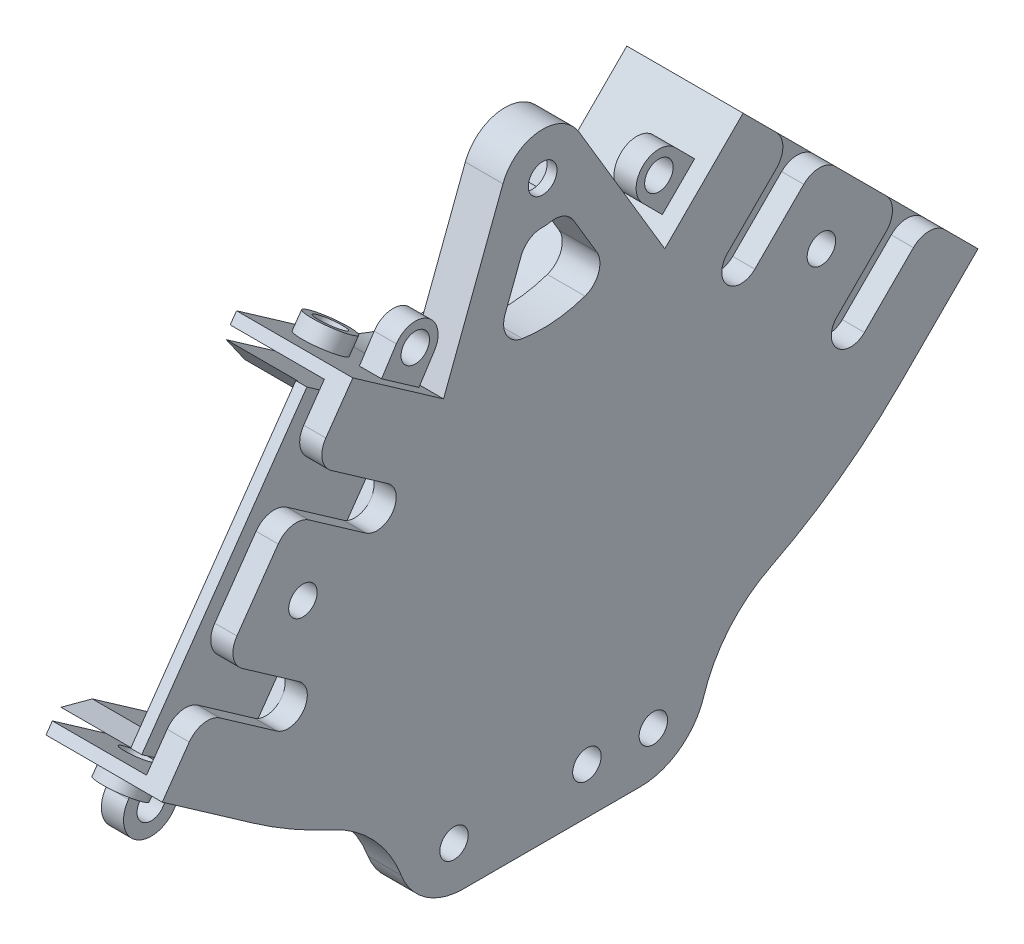
from build123d import *
from build123d.topology import SkipClean

# Parameters (mm, degrees)
BASE_EXTRUDE_DEPTH              = 58.42
BASE_EXTRUDE_2_DEPTH            = 58.42
OUTER_WALL_DEPTH                = 7.62
SKETCH6_W                       = 73.66
SKETCH6_H                       = 76.2
SKETCH6_W_2                     = 68.58
SKETCH6_H_2                     = 71.12
SKETCH6_W_3                     = 63.5
SKETCH6_H_3                     = 66.04
SKETCH6_W_4                     = 58.42
SKETCH6_H_4                     = 60.96
ENDCAP_1_DEPTH                  = 25.4
SKETCH7_W                       = 73.66
SKETCH7_H                       = 76.2
SKETCH7_W_2                     = 68.58
SKETCH7_H_2                     = 71.12
SKETCH7_W_3                     = 63.5
SKETCH7_H_3                     = 66.04
SKETCH7_W_4                     = 58.42
SKETCH7_H_4                     = 60.96
ENDCAP_2_DEPTH                  = 25.4
INTERNAL_CHAMFER_SIZE           = 2.773453185
INTERNAL_CHAMFER_SIZE_2         = 7.62
FLYWHEEL_HOLE_REACH             = 158.41
SKETCH10_W                      = 25.4
SKETCH10_H                      = 177.72143494
SKETCH11_R                      = 4.064
SKETCH11_R_2                    = 2.5
FLYWHEEL_HOLDER_DEPTH           = 7.62
SKETCH12_R                      = 14.605
MOTOR_INSERT_DEPTH              = 6.35
SKETCH14_W                      = 212.132210094
SKETCH14_H                      = 160.972819264
CUT_EXTRUDE2_DEPTH              = 49.53
SKETCH15_R                      = 3.2639
JOINING_SCREW_HOLES_DEPTH       = 5.08
SKETCH16_R                      = 3.2639
FLYWHEEL_COVER_CONNECTORS_DEPTH = 5.08
F_80_20_START                   = -5.08
SKETCH17_R                      = 3.2639
F_80_20_CONNECTOR_DEPTH         = 5.08
FILLET1_R                       = 30.48
FILLET2_R                       = 15.24
SUPPORT_REMOVAL_REACH           = 169.33
FILLET3_R                       = 5.08
CUT_EXTRUDE3_REACH              = 169.33
SKETCH19_R                      = 3.2639
CUT_EXTRUDE4_REACH              = 200.014
SKETCH20_R                      = 3.2639
CUT_EXTRUDE5_REACH              = 197.272
SKETCH21_R                      = 3.2639
SKETCH22_R                      = 3.2639
THICKEN_2_DEPTH                 = 2.54
AXLE_START                      = -8.636
SKETCH23_R                      = 3.302
AXLE_HOLDER_DEPTH               = 8.636
FILLET4_R                       = 5.08
NUT_HOLE_DEPTH                  = 6.35
SKETCH25_R                      = 5.08
SKETCH25_R_2                    = 3.2639
BOSS_EXTRUDE1_DEPTH             = 3.81
BOSS_EXTRUDE2_START             = 3.81
SKETCH26_R                      = 5.08
SKETCH26_R_2                    = 3.2639
BOSS_EXTRUDE2_DEPTH             = 3.81


with BuildPart() as part:
    # Sketch3 → Base extrude (new body)
    with BuildSketch(Plane(origin=(0, 0, 0), x_dir=(0, 0, -1), z_dir=(1, 0, 0))):
        with BuildLine():
            Line((-62.063264719, -88.6355278), (-66.433917164, -94.877466378))
            ThreePointArc((-66.433917164, -94.877466378), (10.094726748, -115.383254712), (81.899935824, -81.899935824))
            Line((81.899935824, -81.899935824), (76.511782152, -76.511782152))
            ThreePointArc((76.511782152, -76.511782152), (9.430599988, -107.792251112), (-62.063264719, -88.6355278))
        make_face()
    extrude(amount=BASE_EXTRUDE_DEPTH)



with BuildPart() as body_2:
    # Sketch3 → Base extrude 2 (new body)
    with BuildSketch(Plane(origin=(0, 0, 0), x_dir=(0, 0, -1), z_dir=(1, 0, 0))):
        with BuildLine():
            ThreePointArc((28.018399098, -28.018399098), (3.453459151, -39.473218717), (-22.727392714, -32.458080603))
            Line((-22.727392714, -32.458080603), (-27.098045159, -38.70001918))
            ThreePointArc((-27.098045159, -38.70001918), (4.11758591, -47.064222317), (33.40655277, -33.40655277))
            Line((33.40655277, -33.40655277), (28.018399098, -28.018399098))
        make_face()
    extrude(amount=BASE_EXTRUDE_2_DEPTH)


with BuildPart() as part_1:
    add(part.part)

    add(body_2.part)  # Outer wall merges body 2
    # Sketch4 → Outer wall (add)
    with BuildSketch(Plane(origin=(58.42, 0, 0), x_dir=(0, 0, -1), z_dir=(1, 0, 0))):
        with BuildLine():
            Line((-66.433917164, -94.877466378), (-22.727392714, -32.458080603))
            ThreePointArc((-22.727392714, -32.458080603), (3.453459151, -39.473218717), (28.018399098, -28.018399098))
            Line((28.018399098, -28.018399098), (81.899935824, -81.899935824))
            ThreePointArc((81.899935824, -81.899935824), (10.094726748, -115.383254712), (-66.433917164, -94.877466378))
        make_face()
    outer_wall = extrude(amount=OUTER_WALL_DEPTH)

    # Mirror1: Outer wall across plane
    add(outer_wall.mirror(Plane.ZY.offset(-29.21)))

    # Sketch6 → Endcap 1 (add)
    # profile 1 of 2: a face of its own
    with BuildSketch(Plane(origin=(0, 0, 0), x_dir=(1, 0, 0), z_dir=(0, 0.5735764363510462, 0.8191520442889917))):
        with Locations((29.21, -77.724)):
            Rectangle(SKETCH6_W, SKETCH6_H)
        with Locations((29.21, -77.724)):
            Rectangle(SKETCH6_W_2, SKETCH6_H_2, mode=Mode.SUBTRACT)
    # profile 2 of 2: a face of its own
    with BuildSketch(Plane(origin=(0, 0, 0), x_dir=(1, 0, 0), z_dir=(0, 0.5735764363510462, 0.8191520442889917))):
        with Locations((29.21, -77.724)):
            Rectangle(SKETCH6_W_3, SKETCH6_H_3)
        with Locations((29.21, -77.724)):
            Rectangle(SKETCH6_W_4, SKETCH6_H_4, mode=Mode.SUBTRACT)
    extrude(amount=ENDCAP_1_DEPTH)

    # Sketch7 → Endcap 2 (add)
    # profile 1 of 2: a face of its own
    with BuildSketch(Plane(origin=(0, 0, 0), x_dir=(1, 0, 0), z_dir=(0, 0.7071067811865503, -0.7071067811865447))):
        with Locations((29.21, 77.724)):
            Rectangle(SKETCH7_W, SKETCH7_H)
        with Locations((29.21, 77.724)):
            Rectangle(SKETCH7_W_2, SKETCH7_H_2, mode=Mode.SUBTRACT)
    # profile 2 of 2: a face of its own
    with BuildSketch(Plane(origin=(0, 0, 0), x_dir=(1, 0, 0), z_dir=(0, 0.7071067811865503, -0.7071067811865447))):
        with Locations((29.21, 77.724)):
            Rectangle(SKETCH7_W_3, SKETCH7_H_3)
        with Locations((29.21, 77.724)):
            Rectangle(SKETCH7_W_4, SKETCH7_H_4, mode=Mode.SUBTRACT)
    extrude(amount=ENDCAP_2_DEPTH)

    # Internal Chamfer
    # the kernel refuses this chamfer: 7.62, 2.773453185 mm, written as the material it takes off along each edge
    with BuildSketch(Plane(origin=(58.42, -15.446040528, -51.367065013), x_dir=(0, 0.7736626875489875, 0.6335977003544738), z_dir=(-1, 0, 0)), Plane(origin=(0, -24.131177697, 47.904507084), x_dir=(0, 0.8719320989550161, -0.489626811778011), z_dir=(1, 0, 0))) as internal_chamfer_piece_1:
        Polygon((INTERNAL_CHAMFER_SIZE * 0.995083363221, -INTERNAL_CHAMFER_SIZE * 0.0990409022559), (-INTERNAL_CHAMFER_SIZE_2 * 0.0990409022521, -INTERNAL_CHAMFER_SIZE_2 * 0.995083363182), (0, 0), align=None)
    extrude(amount=58.42, mode=Mode.SUBTRACT)
    with BuildSketch(Plane(origin=(0, -58.551269909, -94.472294394), x_dir=(0, -0.6977227871251116, 0.7163678610367485), z_dir=(1, 0, 0)), Plane(origin=(58.42, -74.066686317, 82.869726644), x_dir=(0, -0.562726836605906, -0.8266429140587307), z_dir=(-1, 0, 0))) as internal_chamfer_piece_2:
        Polygon((INTERNAL_CHAMFER_SIZE_2 * 0.999913086528, INTERNAL_CHAMFER_SIZE_2 * 0.0131840581986), (-INTERNAL_CHAMFER_SIZE * 0.0131840581992, INTERNAL_CHAMFER_SIZE * 0.999913086567), (0, 0), align=None)
    extrude(amount=58.42, mode=Mode.SUBTRACT)

    # Sketch10 → Flywheel Hole (cut, up to next)
    with BuildSketch(Plane(origin=(0, -13.973562988, -1.22252835), x_dir=(-1, 0, 0), z_dir=(0, -0.9961946980917453, -0.08715574274766034)), mode=Mode.PRIVATE) as flywheel_hole_sk1:
        with Locations((-29.21, 6.675062398)):
            Rectangle(SKETCH10_W, SKETCH10_H)
    flywheel_hole_tool1 = extrude(flywheel_hole_sk1.sketch, amount=FLYWHEEL_HOLE_REACH, mode=Mode.PRIVATE) & part_1.part
    add(flywheel_hole_tool1.solids().sort_by_distance((29.21, -13.391793, -7.87219))[0], mode=Mode.SUBTRACT)

    # Sketch11 → Flywheel holder (add)
    with BuildSketch(Plane.ZY.offset(7.62)):
        with BuildLine():
            Line((-25.298191602, 2.271893855), (-28.018399098, -28.018399098))
            ThreePointArc((-28.018399098, -28.018399098), (-17.263469888, -35.665585421), (-4.593712298, -39.356818765))
            Line((-4.593712298, -39.356818765), (-3.063575879, -22.31830958))
            ThreePointArc((-3.063575879, -22.31830958), (1.55249301, -17.71209094), (6.899502357, -21.445029888))
            Line((6.899502357, -21.445029888), (11.370438714, -37.957535477))
            ThreePointArc((11.370438714, -37.957535477), (17.269236463, -35.662793609), (22.727392714, -32.458080603))
            Line((22.727392714, -32.458080603), (33.130623676, -25.173659861))
            Line((33.130623676, -25.173659861), (24.517199578, 6.638292315))
            ThreePointArc((24.517199578, 6.638292315), (-2.217847157, 25.302987057), (-25.298191602, 2.271893855))
        make_face()
        Circle(SKETCH11_R, mode=Mode.SUBTRACT)
        with Locations((-20.421702152, -1.789994753)):
            Circle(SKETCH11_R_2, mode=Mode.SUBTRACT)
        with Locations((20.421702152, 1.789994753)):
            Circle(SKETCH11_R_2, mode=Mode.SUBTRACT)
    extrude(amount=-FLYWHEEL_HOLDER_DEPTH)

    # Sketch12 → Motor insert (cut)
    with BuildSketch(Plane.ZY.offset(7.62)):
        Circle(SKETCH12_R)
    extrude(amount=-MOTOR_INSERT_DEPTH, mode=Mode.SUBTRACT)

    # Sketch14 → Cut-Extrude2 (cut)
    with BuildSketch(Plane.ZY.offset(7.62)):
        with Locations((-0.510154839, -39.532122181)):
            Rectangle(SKETCH14_W, SKETCH14_H)
    extrude(amount=-CUT_EXTRUDE2_DEPTH, mode=Mode.SUBTRACT)

    # Sketch15 → Joining screw holes (add)
    # profile 1 of 3: a face of its own
    with BuildSketch(Plane.ZY.offset(-41.91)):
        with BuildLine():
            Line((-89.621167975, -74.178703673), (-93.808320694, -77.730793631))
            ThreePointArc((-93.808320694, -77.730793631), (-94.293535912, -86.957846302), (-85.053908121, -86.901162291))
            Line((-85.053908121, -86.901162291), (-80.631239272, -83.149276783))
            ThreePointArc((-80.631239272, -83.149276783), (-81.267988364, -82.527044314), (-81.899935824, -81.899935824))
            Line((-81.899935824, -81.899935824), (-89.621167975, -74.178703673))
        make_face()
        with Locations(Location((-89.700448066, -82.573094993, 0), (0, 0, 270))):
            Circle(SKETCH15_R, mode=Mode.SUBTRACT)
    # profile 2 of 3: a face of its own
    with BuildSketch(Plane.ZY.offset(-41.91)):
        with BuildLine():
            ThreePointArc((-3.85934265, -115.759684045), (-10.200012116, -115.373995029), (-16.51, -114.641261664))
            Line((-16.51, -114.641261664), (-16.51, -121.49592915))
            ThreePointArc((-16.51, -121.49592915), (-9.764193336, -127.833581482), (-3.85934265, -120.705855126))
            Line((-3.85934265, -120.705855126), (-3.85934265, -115.759684045))
        make_face()
        with Locations(Location((-10.16, -121.49592915, 0), (0, 0, 270))):
            Circle(SKETCH15_R, mode=Mode.SUBTRACT)
    # profile 3 of 3: a face of its own
    with BuildSketch(Plane.ZY.offset(-41.91)):
        with BuildLine():
            ThreePointArc((66.433917164, -94.877466378), (62.923155577, -97.241325928), (59.32837287, -99.475339399))
            Line((59.32837287, -99.475339399), (62.868028779, -104.530491931))
            Line((62.868028779, -104.530491931), (63.115503756, -104.883922825))
            ThreePointArc((63.115503756, -104.883922825), (71.906047644, -106.216498213), (73.412285238, -97.454040377))
            Line((73.412285238, -97.454040377), (73.371541167, -97.395851813))
            Line((73.371541167, -97.395851813), (69.905878638, -92.446372781))
            Line((69.905878638, -92.446372781), (66.433917164, -94.877466378))
        make_face()
        with Locations(Location((68.190379089, -101.067099492, 0), (0, 0, 270))):
            Circle(SKETCH15_R, mode=Mode.SUBTRACT)
    extrude(amount=-JOINING_SCREW_HOLES_DEPTH)

    # Sketch16 → Flywheel cover connectors (add)
    # profile 1 of 2: a face of its own
    with BuildSketch(Plane(origin=(59.69, 0, 0), x_dir=(0, 0, -1), z_dir=(1, 0, 0))):
        with BuildLine():
            ThreePointArc((-21.17939876, -25.923451894), (-22.40017027, -18.550581346), (-29.745930764, -19.925101608))
            Line((-29.745930764, -19.925101608), (-33.130623676, -25.173659861))
            Line((-33.130623676, -25.173659861), (-24.564091672, -31.172010147))
            Line((-24.564091672, -31.172010147), (-21.17939876, -25.923451894))
        make_face()
        with Locations((-25.4, -22.834782196)):
            Circle(SKETCH16_R, mode=Mode.SUBTRACT)
    # profile 2 of 2: a face of its own
    with BuildSketch(Plane(origin=(59.69, 0, 0), x_dir=(0, 0, -1), z_dir=(1, 0, 0))):
        with BuildLine():
            Line((26.781800754, -20.274741321), (31.271928814, -24.764869381))
            Line((31.271928814, -24.764869381), (38.668327307, -17.368470889))
            Line((38.668327307, -17.368470889), (34.178199246, -12.878342828))
            ThreePointArc((34.178199246, -12.878342828), (26.781800754, -12.878342828), (26.781800754, -20.274741321))
        make_face()
        with Locations((30.48, -16.576542074)):
            Circle(SKETCH16_R, mode=Mode.SUBTRACT)
    extrude(amount=FLYWHEEL_COVER_CONNECTORS_DEPTH)

    # Sketch17 → 80-20 connector (add)
    with BuildSketch(Plane(origin=(66.04, 0, 0), x_dir=(0, 0, -1), z_dir=(1, 0, 0)).offset(F_80_20_START)):
        with BuildLine():
            Line((-30.48, -111.741525746), (-30.48, -132.08))
            Line((-30.48, -132.08), (35.56, -132.08))
            Line((35.56, -132.08), (35.56, -110.23014731))
            ThreePointArc((35.56, -110.23014731), (2.650031357, -115.793679922), (-30.48, -111.741525746))
        make_face()
        with Locations((-20.32, -121.92)):
            Circle(SKETCH17_R, mode=Mode.SUBTRACT)
        with Locations((25.4, -121.92)):
            Circle(SKETCH17_R, mode=Mode.SUBTRACT)
        with Locations(Location((10.16, -121.49592915, 0), (0, 0, 270))):
            Circle(SKETCH17_R, mode=Mode.SUBTRACT)
    extrude(amount=F_80_20_CONNECTOR_DEPTH)

    # Fillet1
    # the kernel refuses this fillet: 30.48 mm, written as the material it adds along each edge
    with BuildSketch(Plane(origin=(60.96, -111.741525746, 30.48), x_dir=(0, 0.341001357032678, 0.9400628034880818), z_dir=(1, 0, 0))) as fillet1_piece_1:
        with BuildLine():
            CenterArc((21.388873665, 30.3783614), FILLET1_R, 201.677822045, 63.641807356)
            Line((-6.935447321, 19.119443126), (-7.50193374, 18.894264761))
            ThreePointArc((-7.50193374, 18.894264761), (-4.040785945, 9.351847136), (-0.573062285, -0.207874427))
            Line((-0.573062285, -0.207874427), (0.049741567, -0.607567228))
            ThreePointArc((0.049741567, -0.607567228), (9.450897666, -0.223373321), (18.852053765, -0.607567228))
            Line((18.852053765, -0.607567228), (18.901795332, 0))
        make_face()
    extrude(amount=5.08)
    with BuildSketch(Plane(origin=(60.96, -110.23014731, -35.56), x_dir=(0, 0.38036360514981254, -0.9248370277391782), z_dir=(1, 0, 0))) as fillet1_piece_2:
        with BuildLine():
            CenterArc((20.459697652, -30.38701358), FILLET1_R, 94.47662158, 63.167171408)
            Line((-7.729334953, -18.793530895), (-8.293115606, -18.561661241))
            Line((-8.293115606, -18.561661241), (-0.563780652, 0.231869654))
            Line((-0.563780652, 0.231869654), (0.047580692, 0.607740272))
            ThreePointArc((0.047580692, 0.607740272), (9.040331521, 0.256251605), (18.033082349, 0.607740272))
            Line((18.033082349, 0.607740272), (18.080663041, 0))
        make_face()
    extrude(amount=5.08)

    # Fillet2
    fillet2_edges = [part_1.edges().sort_by_distance(p)[0] for p in [
        (63.5, -132.08, -35.56),
        (63.5, -132.08, 30.48),
    ]]
    fillet(fillet2_edges, radius=FILLET2_R)

    # Sketch18 → Support Removal (cut, up to next)
    with BuildSketch(Plane(origin=(66.04, 0, 0), x_dir=(0, 0, -1), z_dir=(1, 0, 0)), mode=Mode.PRIVATE) as support_removal_sk1:
        with BuildLine():
            Line((-35.474049478, -42.912572046), (-52.639380566, -30.893277823))
            Line((-52.639380566, -30.893277823), (-57.738475085, -38.175539496))
            Line((-57.738475085, -38.175539496), (-40.573143997, -50.19483372))
            ThreePointArc((-40.573143997, -50.19483372), (-34.382465901, -49.103250143), (-35.474049478, -42.912572046))
        make_face()
    support_removal_tool1 = extrude(support_removal_sk1.sketch, amount=-SUPPORT_REMOVAL_REACH, mode=Mode.PRIVATE) & part_1.part
    # Sketch18 → Support Removal (cut, up to next)
    with BuildSketch(Plane(origin=(66.04, 0, 0), x_dir=(0, 0, -1), z_dir=(1, 0, 0)), mode=Mode.PRIVATE) as support_removal_sk2:
        with BuildLine():
            Line((-55.870427555, -72.041618741), (-73.035758643, -60.022324518))
            Line((-73.035758643, -60.022324518), (-78.134853162, -67.304586191))
            Line((-78.134853162, -67.304586191), (-60.969522074, -79.323880415))
            ThreePointArc((-60.969522074, -79.323880415), (-54.778843977, -78.232296838), (-55.870427555, -72.041618741))
        make_face()
    support_removal_tool2 = extrude(support_removal_sk2.sketch, amount=-SUPPORT_REMOVAL_REACH, mode=Mode.PRIVATE) & part_1.part
    # Sketch18 → Support Removal (cut, up to next)
    with BuildSketch(Plane(origin=(66.04, 0, 0), x_dir=(0, 0, -1), z_dir=(1, 0, 0)), mode=Mode.PRIVATE) as support_removal_sk3:
        with BuildLine():
            Line((42.386808891, -36.100629607), (57.204231491, -21.283207007))
            Line((57.204231491, -21.283207007), (63.490410776, -27.569386292))
            Line((63.490410776, -27.569386292), (48.672988176, -42.386808891))
            ThreePointArc((48.672988176, -42.386808891), (42.386808891, -42.386808891), (42.386808891, -36.100629607))
        make_face()
    support_removal_tool3 = extrude(support_removal_sk3.sketch, amount=-SUPPORT_REMOVAL_REACH, mode=Mode.PRIVATE) & part_1.part
    # Sketch18 → Support Removal (cut, up to next)
    with BuildSketch(Plane(origin=(66.04, 0, 0), x_dir=(0, 0, -1), z_dir=(1, 0, 0)), mode=Mode.PRIVATE) as support_removal_sk4:
        with BuildLine():
            Line((67.53152603, -61.245346746), (82.34894863, -46.427924146))
            Line((82.34894863, -46.427924146), (88.635127915, -52.714103431))
            Line((88.635127915, -52.714103431), (73.817705315, -67.53152603))
            ThreePointArc((73.817705315, -67.53152603), (67.53152603, -67.53152603), (67.53152603, -61.245346746))
        make_face()
    support_removal_tool4 = extrude(support_removal_sk4.sketch, amount=-SUPPORT_REMOVAL_REACH, mode=Mode.PRIVATE) & part_1.part
    add(support_removal_tool1.solids().sort_by_distance((66.04, -41.556808, 45.159903))[0], mode=Mode.SUBTRACT)
    add(support_removal_tool2.solids().sort_by_distance((66.04, -70.685854, 65.556281))[0], mode=Mode.SUBTRACT)
    add(support_removal_tool3.solids().sort_by_distance((66.04, -33.083531, -51.690086))[0], mode=Mode.SUBTRACT)
    add(support_removal_tool4.solids().sort_by_distance((66.04, -58.228249, -76.834803))[0], mode=Mode.SUBTRACT)

    # Fillet3
    fillet3_edges = [part_1.edges().sort_by_distance(p)[0] for p in [
        (64.77, -46.427924146, -82.34894863),
        (64.77, -52.714103431, -88.635127915),
        (64.77, -21.283207007, -57.204231491),
        (64.77, -27.569386292, -63.490410776),
        (64.77, -67.304586191, 78.134853162),
        (64.77, -60.022324518, 73.035758643),
        (64.77, -38.175539496, 57.738475085),
        (64.77, -30.893277823, 52.639380566),
    ]]
    fillet(fillet3_edges, radius=FILLET3_R)

    # Sketch19 → Cut-Extrude3 (cut, up to next)
    with BuildSketch(Plane(origin=(66.04, 0, 0), x_dir=(0, 0, -1), z_dir=(1, 0, 0)), mode=Mode.PRIVATE) as cut_extrude3_sk1:
        with Locations((63.939423582, -45.97891134)):
            Circle(SKETCH19_R)
    cut_extrude3_tool1 = extrude(cut_extrude3_sk1.sketch, amount=-CUT_EXTRUDE3_REACH, mode=Mode.PRIVATE) & part_1.part
    # Sketch19 → Cut-Extrude3 (cut, up to next)
    with BuildSketch(Plane(origin=(66.04, 0, 0), x_dir=(0, 0, -1), z_dir=(1, 0, 0)), mode=Mode.PRIVATE) as cut_extrude3_sk2:
        with Locations((-54.983885901, -56.383352749)):
            Circle(SKETCH19_R)
    cut_extrude3_tool2 = extrude(cut_extrude3_sk2.sketch, amount=-CUT_EXTRUDE3_REACH, mode=Mode.PRIVATE) & part_1.part
    add(cut_extrude3_tool1.solids().sort_by_distance((66.04, -45.978911, -63.939424))[0], mode=Mode.SUBTRACT)
    add(cut_extrude3_tool2.solids().sort_by_distance((66.04, -56.383353, 54.983886))[0], mode=Mode.SUBTRACT)

    # Sketch20 → Cut-Extrude4 (cut, up to next)
    with BuildSketch(Plane(origin=(0, -94.877466378, 66.433917164), x_dir=(1, 0, 0), z_dir=(0, -0.8191520442889918, 0.5735764363510464)), mode=Mode.PRIVATE) as cut_extrude4_sk1:
        with Locations(Location((50.8, 12.7, 0), (0, 0, 270))):
            Circle(SKETCH20_R)
    cut_extrude4_tool1 = extrude(cut_extrude4_sk1.sketch, amount=-CUT_EXTRUDE4_REACH, mode=Mode.PRIVATE) & part_1.part
    cut_extrude4 = cut_extrude4_tool1.solids().sort_by_distance((50.8, -87.593046, 76.837148))[0]
    add(cut_extrude4, mode=Mode.SUBTRACT)

    # Mirror2: Cut-Extrude4 across plane
    add(cut_extrude4.mirror(Plane(origin=(0, -63.66777349, 44.580654939), x_dir=(0, 0.5735764363510465, 0.8191520442889916), z_dir=(0, 0.8191520442889918, -0.5735764363510464))), mode=Mode.SUBTRACT)

    # Sketch21 → Cut-Extrude5 (cut, up to next)
    with BuildSketch(Plane(origin=(0, -81.899935824, -81.899935824), x_dir=(1, 0, 0), z_dir=(0, -0.7071067811865449, -0.7071067811865501)), mode=Mode.PRIVATE) as cut_extrude5_sk1:
        with Locations(Location((50.8, -12.7, 0), (0, 0, 270))):
            Circle(SKETCH21_R)
    cut_extrude5_tool1 = extrude(cut_extrude5_sk1.sketch, amount=-CUT_EXTRUDE5_REACH, mode=Mode.PRIVATE) & part_1.part
    add(cut_extrude5_tool1.solids().sort_by_distance((50.8, -72.91968, -90.880192))[0], mode=Mode.SUBTRACT)

    # Sketch22 → Thicken 2 (add)
    with SkipClean():  # the faces are left unmerged after this step: merging them gives an invalid solid
        with BuildSketch(Plane(origin=(66.04, 0, 0), x_dir=(0, 0, -1), z_dir=(1, 0, 0))):
            with BuildLine():
                Line((81.899935824, -81.899935824), (99.860448066, -63.939423582))
                Line((99.860448066, -63.939423582), (92.227230363, -56.306205879))
                ThreePointArc((92.227230363, -56.306205879), (88.635127915, -54.818308328), (85.043025467, -56.306205879))
                Line((85.043025467, -56.306205879), (73.817705315, -67.53152603))
                ThreePointArc((73.817705315, -67.53152603), (67.53152603, -67.53152603), (67.53152603, -61.245346746))
                Line((67.53152603, -61.245346746), (78.756846182, -50.020026594))
                ThreePointArc((78.756846182, -50.020026594), (80.244743733, -46.427924146), (78.756846182, -42.835821697))
                Line((78.756846182, -42.835821697), (67.082513224, -31.16148874))
                ThreePointArc((67.082513224, -31.16148874), (63.490410776, -29.673591189), (59.898308328, -31.16148874))
                Line((59.898308328, -31.16148874), (48.672988176, -42.386808891))
                ThreePointArc((48.672988176, -42.386808891), (42.386808891, -42.386808891), (42.386808891, -36.100629607))
                Line((42.386808891, -36.100629607), (53.612129043, -24.875309455))
                ThreePointArc((53.612129043, -24.875309455), (55.100026594, -21.283207007), (53.612129043, -17.691104559))
                Line((53.612129043, -17.691104559), (45.97891134, -10.057886856))
                Line((45.97891134, -10.057886856), (28.018399098, -28.018399098))
                ThreePointArc((28.018399098, -28.018399098), (3.453459151, -39.473218717), (-22.727392714, -32.458080603))
                Line((-22.727392714, -32.458080603), (-43.533854639, -17.88923912))
                Line((-43.533854639, -17.88923912), (-49.725612269, -26.731985438))
                ThreePointArc((-49.725612269, -26.731985438), (-50.56714327, -30.527886477), (-48.478088181, -33.807046119))
                Line((-48.478088181, -33.807046119), (-35.474049478, -42.912572046))
                ThreePointArc((-35.474049478, -42.912572046), (-34.382465901, -49.103250143), (-40.573143997, -50.19483372))
                Line((-40.573143997, -50.19483372), (-53.5771827, -41.089307793))
                ThreePointArc((-53.5771827, -41.089307793), (-57.373083739, -40.247776793), (-60.652243382, -42.336831881))
                Line((-60.652243382, -42.336831881), (-70.121990346, -55.861032133))
                ThreePointArc((-70.121990346, -55.861032133), (-70.963521346, -59.656933172), (-68.874466258, -62.936092814))
                Line((-68.874466258, -62.936092814), (-55.870427555, -72.041618741))
                ThreePointArc((-55.870427555, -72.041618741), (-54.778843977, -78.232296838), (-60.969522074, -79.323880415))
                Line((-60.969522074, -79.323880415), (-73.973560777, -70.218354488))
                ThreePointArc((-73.973560777, -70.218354488), (-77.769461816, -69.376823488), (-81.048621458, -71.465878576))
                Line((-81.048621458, -71.465878576), (-87.240379089, -80.308624894))
                Line((-87.240379089, -80.308624894), (-66.433917164, -94.877466378))
                ThreePointArc((-66.433917164, -94.877466378), (-57.577531083, -100.498889996), (-48.248874711, -105.295987887))
                ThreePointArc((-48.248874711, -105.295987887), (-38.670234972, -112.201058525), (-32.434769037, -122.228486128))
                ThreePointArc((-32.434769037, -122.228486128), (-26.843390099, -129.377506303), (-18.179180054, -132.08))
                Line((-18.179180054, -132.08), (22.424345917, -132.08))
                ThreePointArc((22.424345917, -132.08), (31.441147567, -129.12637001), (36.962897278, -121.410352757))
                ThreePointArc((36.962897278, -121.410352757), (42.797014935, -110.8331972), (52.281666667, -103.352921132))
                ThreePointArc((52.281666667, -103.352921132), (67.94286759, -93.802802301), (81.899935824, -81.899935824))
            make_face()
            with Locations((-20.32, -121.92)):
                Circle(SKETCH22_R, mode=Mode.SUBTRACT)
            with Locations((10.16, -121.49592915)):
                Circle(SKETCH22_R, mode=Mode.SUBTRACT)
            with Locations((25.4, -121.92)):
                Circle(SKETCH22_R, mode=Mode.SUBTRACT)
            with Locations((-54.983885901, -56.383352749)):
                Circle(SKETCH22_R, mode=Mode.SUBTRACT)
            with Locations((63.939423582, -45.97891134)):
                Circle(SKETCH22_R, mode=Mode.SUBTRACT)
        extrude(amount=THICKEN_2_DEPTH)

    # Sketch23 → Axle Holder (add)
    with SkipClean():  # the faces are left unmerged after this step: merging them gives an invalid solid
        with BuildSketch(Plane(origin=(68.58, 0, 0), x_dir=(0, 0, -1), z_dir=(1, 0, 0)).offset(AXLE_START)):
            with BuildLine():
                Line((-9.101348505, 3.453366213), (-22.727392714, -32.458080603))
                ThreePointArc((-22.727392714, -32.458080603), (3.453459151, -39.473218717), (28.018399098, -28.018399098))
                Line((28.018399098, -28.018399098), (8.363407821, 4.981334403))
                ThreePointArc((8.363407821, 4.981334403), (-0.848416649, 9.697446674), (-9.101348505, 3.453366213))
            make_face()
            Circle(SKETCH23_R, mode=Mode.SUBTRACT)
            with BuildLine():
                Line((-3.453366213, -9.101348505), (-10.603476213, -27.945467243))
                ThreePointArc((-10.603476213, -27.945467243), (2.605042502, -29.775772043), (15.295065044, -25.679638481))
                Line((15.295065044, -25.679638481), (4.981334403, -8.363407821))
                ThreePointArc((4.981334403, -8.363407821), (0.848416649, -9.697446674), (-3.453366213, -9.101348505))
            make_face(mode=Mode.SUBTRACT)
        extrude(amount=AXLE_HOLDER_DEPTH)

    # Fillet4
    fillet4_edges = [part_1.edges().sort_by_distance(p)[0] for p in [
        (64.262, -9.101348505, 3.453366213),
        (64.262, -27.945467243, 10.603476213),
        (64.262, -25.679638481, -15.295065044),
        (64.262, -8.363407821, -4.981334403),
    ]]
    fillet(fillet4_edges, radius=FILLET4_R)

    # Sketch24 → Nut hole (cut)
    with SkipClean():  # the faces are left unmerged after this step: merging them gives an invalid solid
        with BuildSketch(Plane.ZY.offset(-59.944)):
            Polygon((-3.226233304, 5.588), (3.226233304, 5.588), (6.452466608, 0), (3.226233304, -5.588), (-3.226233304, -5.588), (-6.452466608, 0), align=None)
        extrude(amount=-NUT_HOLE_DEPTH, mode=Mode.SUBTRACT)

    # Sketch25 → Boss-Extrude1 (add)
    with SkipClean():  # the faces are left unmerged after this step: merging them gives an invalid solid
        with BuildSketch(Plane(origin=(0, -32.458080603, 22.727392714), x_dir=(1, 0, 0), z_dir=(0, 0.8191520442889918, -0.5735764363510464))):
            with Locations(Location((50.8, -12.7, 0), (0, 0, 90))):
                Circle(SKETCH25_R)
            with Locations(Location((50.8, -12.7, 0), (0, 0, 90))):
                Circle(SKETCH25_R_2, mode=Mode.SUBTRACT)
        extrude(amount=BOSS_EXTRUDE1_DEPTH)

    # Sketch26 → Boss-Extrude2 (add)
    with SkipClean():  # the faces are left unmerged after this step: merging them gives an invalid solid
        with BuildSketch(Plane(origin=(0, -94.877466378, 66.433917164), x_dir=(1, 0, 0), z_dir=(0, -0.8191520442889918, 0.5735764363510464)).offset(BOSS_EXTRUDE2_START)):
            with Locations(Location((50.8, 12.7, 0), (0, 0, 270))):
                Circle(SKETCH26_R)
            with Locations(Location((50.8, 12.7, 0), (0, 0, 270))):
                Circle(SKETCH26_R_2, mode=Mode.SUBTRACT)
        extrude(amount=-BOSS_EXTRUDE2_DEPTH)


solid = part_1.part
